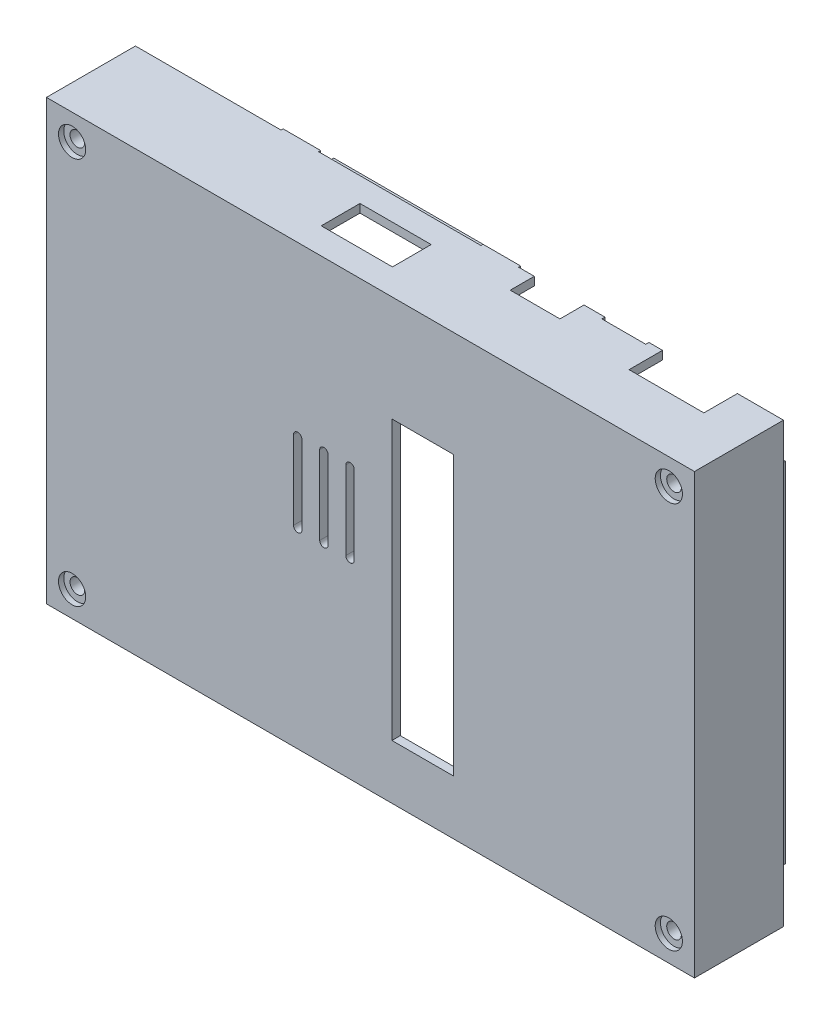
from build123d import *

# Parameters (mm, degrees)
SKETCH1_W               = 120.6
SKETCH1_H               = 80.6
BOSS_EXTRUDE1_DEPTH     = 1.6
SKETCH2_W               = 123.8
SKETCH2_H               = 83.8
BOSS_EXTRUDE2_DEPTH     = 1.6
SKETCH15_W              = 54.6
SKETCH15_H              = 1.6
BOSS_EXTRUDE10_DEPTH    = 15.4
SKETCH16_R              = 3.55
CUT_EXTRUDE5_DEPTH      = 15.5
BOSS_EXTRUDE11_DEPTH    = 15.4
SKETCH18_W              = 1.6
SKETCH18_H              = 3.2
SKETCH18_H_2            = 2.6
BOSS_EXTRUDE12_DEPTH    = 18
BOSS_EXTRUDE13_DEPTH    = 15.4
SKETCH20_W              = 15
SKETCH20_H              = 1.6
BOSS_EXTRUDE14_DEPTH    = 15.4
BOSS_EXTRUDE15_DEPTH    = 15.4
SKETCH22_W              = 62.6
SKETCH22_H              = 1.6
BOSS_EXTRUDE16_DEPTH    = 6
SKETCH23_W              = 1.6
SKETCH23_H              = 31.4
BOSS_EXTRUDE17_DEPTH    = 5.6
SKETCH24_W              = 1.6
SKETCH24_H              = 24.7
BOSS_EXTRUDE18_DEPTH    = 5.6
SKETCH25_W              = 11.5
SKETCH25_H              = 1.6
BOSS_EXTRUDE19_DEPTH    = 10.8
SKETCH26_W              = 14.3
SKETCH26_H              = 1.6
BOSS_EXTRUDE20_DEPTH    = 9
SKETCH27_W              = 8.4
SKETCH27_H              = 1.6
CUT_EXTRUDE6_DEPTH      = 0.6
SKETCH29_W              = 7
SKETCH29_H              = 7
BOSS_EXTRUDE21_DEPTH    = 2
CUT_EXTRUDE8_DEPTH      = 77.884458768
CUT_EXTRUDE8_DEPTH_BACK = 77.884458768
SKETCH28_R              = 1.4
SKETCH30_R              = 2.6
CUT_EXTRUDE9_DEPTH      = 1
SKETCH31_W              = 11.8
SKETCH31_H              = 53.2
CUT_EXTRUDE11_DEPTH     = 78.274704788
SKETCH32_W              = 13.6
SKETCH32_H              = 7.4
CUT_EXTRUDE12_DEPTH     = 10
SKETCH34_W              = 7.2
SKETCH34_H              = 1.6
BOSS_EXTRUDE22_DEPTH    = 0.4
SKETCH35_W              = 7.2
SKETCH35_H              = 1.6
BOSS_EXTRUDE23_DEPTH    = 0.4
SKETCH36_W              = 4
SKETCH36_H              = 66.6
BOSS_EXTRUDE25_DEPTH    = 1.2
SKETCH37_W              = 4
SKETCH37_H              = 11.4
BOSS_EXTRUDE31_DEPTH    = 1.2
SKETCH37_2_W            = 4
SKETCH37_2_H            = 11.4
BOSS_EXTRUDE36_DEPTH    = 1.2
SKETCH37_3_W            = 4
SKETCH37_3_H            = 11.4
BOSS_EXTRUDE37_DEPTH    = 1.2
SKETCH38_W              = 29.4
SKETCH38_H              = 4
BOSS_EXTRUDE40_DEPTH    = 1.2
CHAMFER1_SIZE           = 1.2
SKETCH39_W              = 18
SKETCH39_H              = 2.6
BOSS_EXTRUDE41_DEPTH    = 2


with BuildPart() as part:
    # Sketch1 → Boss-Extrude1 (new body)
    with BuildSketch(Plane.XY):
        Rectangle(SKETCH1_W, SKETCH1_H)
    extrude(amount=BOSS_EXTRUDE1_DEPTH)

    # Sketch2 → Boss-Extrude2 (add)
    with BuildSketch(Plane.XY):
        Rectangle(SKETCH2_W, SKETCH2_H)
    extrude(amount=BOSS_EXTRUDE2_DEPTH)

    # Sketch15 → Boss-Extrude10 (add)
    with BuildSketch(Plane(origin=(0, 0, 0), x_dir=(-1, 0, 0), z_dir=(0, 0, -1))):
        with Locations((-34.6, -41.1)):
            Rectangle(SKETCH15_W, SKETCH15_H)
    extrude(amount=BOSS_EXTRUDE10_DEPTH)

    # Sketch16 → Cut-Extrude5 (cut)
    with BuildSketch(Plane.XZ.offset(41.9)):
        with Locations((47.3, -15.4)):
            Circle(SKETCH16_R)
        with Locations((32.1, -15.4)):
            Circle(SKETCH16_R)
    extrude(amount=-CUT_EXTRUDE5_DEPTH, mode=Mode.SUBTRACT)

    # Sketch17 → Boss-Extrude11 (add)
    with BuildSketch(Plane(origin=(0, 0, 0), x_dir=(-1, 0, 0), z_dir=(0, 0, -1))):
        Polygon((55.3, -41.9), (61.9, -41.9), (61.9, -26.1), (60.3, -26.1), (60.3, -40.3), (55.3, -40.3), align=None)
    extrude(amount=BOSS_EXTRUDE11_DEPTH)

    # Sketch18 → Boss-Extrude12 (add)
    with BuildSketch(Plane(origin=(0, 0, 0), x_dir=(-1, 0, 0), z_dir=(0, 0, -1))):
        with Locations((61.1, -24.5)):
            Rectangle(SKETCH18_W, SKETCH18_H)
        with Locations((61.1, 9.8)):
            Rectangle(SKETCH18_W, SKETCH18_H_2)
    extrude(amount=BOSS_EXTRUDE12_DEPTH)

    # Sketch19 → Boss-Extrude13 (add)
    with BuildSketch(Plane(origin=(0, 0, 0), x_dir=(-1, 0, 0), z_dir=(0, 0, -1))):
        Polygon((60.3, 35.8), (61.9, 35.8), (61.9, 41.9), (-14.3, 41.9), (-14.3, 40.3), (60.3, 40.3), align=None)
    extrude(amount=BOSS_EXTRUDE13_DEPTH)

    # Sketch20 → Boss-Extrude14 (add)
    with BuildSketch(Plane(origin=(0, 0, 0), x_dir=(-1, 0, 0), z_dir=(0, 0, -1))):
        with Locations((-31.3, 41.1)):
            Rectangle(SKETCH20_W, SKETCH20_H)
    extrude(amount=BOSS_EXTRUDE14_DEPTH)

    # Sketch21 → Boss-Extrude15 (add)
    with BuildSketch(Plane(origin=(0, 0, 0), x_dir=(-1, 0, 0), z_dir=(0, 0, -1))):
        Polygon((-53.1, 40.3), (-53.1, 41.9), (-61.9, 41.9), (-61.9, -40.3), (-60.3, -40.3), (-60.3, 40.3), align=None)
    extrude(amount=BOSS_EXTRUDE15_DEPTH)

    # Sketch22 → Boss-Extrude16 (add)
    with BuildSketch(Plane(origin=(0, 0, 0), x_dir=(-1, 0, 0), z_dir=(0, 0, -1))):
        with Locations((24, -41.1)):
            Rectangle(SKETCH22_W, SKETCH22_H)
    extrude(amount=BOSS_EXTRUDE16_DEPTH)

    # Sketch23 → Boss-Extrude17 (add)
    with BuildSketch(Plane(origin=(0, 0, 0), x_dir=(-1, 0, 0), z_dir=(0, 0, -1))):
        with Locations((61.1, -7.2)):
            Rectangle(SKETCH23_W, SKETCH23_H)
    extrude(amount=BOSS_EXTRUDE17_DEPTH)

    # Sketch24 → Boss-Extrude18 (add)
    with BuildSketch(Plane(origin=(0, 0, 0), x_dir=(-1, 0, 0), z_dir=(0, 0, -1))):
        with Locations((61.1, 23.45)):
            Rectangle(SKETCH24_W, SKETCH24_H)
    extrude(amount=BOSS_EXTRUDE18_DEPTH)

    # Sketch25 → Boss-Extrude19 (add)
    with BuildSketch(Plane(origin=(0, 0, 0), x_dir=(-1, 0, 0), z_dir=(0, 0, -1))):
        with Locations((-19.65, 41.1)):
            Rectangle(SKETCH25_W, SKETCH25_H)
    extrude(amount=BOSS_EXTRUDE19_DEPTH)

    # Sketch26 → Boss-Extrude20 (add)
    with BuildSketch(Plane(origin=(0, 0, 0), x_dir=(-1, 0, 0), z_dir=(0, 0, -1))):
        with Locations((-45.95, 41.1)):
            Rectangle(SKETCH26_W, SKETCH26_H)
    extrude(amount=BOSS_EXTRUDE20_DEPTH)

    # Sketch27 → Cut-Extrude6 (cut)
    with BuildSketch(Plane(origin=(0, 0, -15.4), x_dir=(-1, 0, 0), z_dir=(0, 0, -1))):
        with Locations((-32, 41.1)):
            Rectangle(SKETCH27_W, SKETCH27_H)
    extrude(amount=-CUT_EXTRUDE6_DEPTH, mode=Mode.SUBTRACT)

    # Sketch29 → Boss-Extrude21 (add)
    with BuildSketch(Plane(origin=(0, 0, 0), x_dir=(-1, 0, 0), z_dir=(0, 0, -1))):
        with Locations((-56.8, -36.8)):
            Rectangle(SKETCH29_W, SKETCH29_H)
        with Locations((-56.8, 36.8)):
            Rectangle(SKETCH29_W, SKETCH29_H)
        with Locations((56.8, 36.8)):
            Rectangle(SKETCH29_W, SKETCH29_H)
        with Locations((56.8, -36.8)):
            Rectangle(SKETCH29_W, SKETCH29_H)
    extrude(amount=BOSS_EXTRUDE21_DEPTH)

    # Sketch28 → Cut-Extrude8 (cut, two sides: drawn at the far end of the back side and taken through both)
    with BuildSketch(Plane(origin=(0, 0, 0), x_dir=(-1, 0, 0), z_dir=(0, 0, -1)).offset(-CUT_EXTRUDE8_DEPTH_BACK)):
        with Locations((-57, 37)):
            Circle(SKETCH28_R)
        with Locations((57, 37)):
            Circle(SKETCH28_R)
        with Locations((57, -37)):
            Circle(SKETCH28_R)
        with Locations((-57, -37)):
            Circle(SKETCH28_R)
    extrude(amount=CUT_EXTRUDE8_DEPTH + CUT_EXTRUDE8_DEPTH_BACK, mode=Mode.SUBTRACT)

    # Sketch30 → Cut-Extrude9 (cut)
    with BuildSketch(Plane.XY.offset(1.6)):
        with Locations((-57, 37)):
            Circle(SKETCH30_R)
        with Locations((57, 37)):
            Circle(SKETCH30_R)
        with Locations((57, -37)):
            Circle(SKETCH30_R)
        with Locations((-57, -37)):
            Circle(SKETCH30_R)
    extrude(amount=-CUT_EXTRUDE9_DEPTH, mode=Mode.SUBTRACT)

    # Sketch31 → Cut-Extrude11 (cut, through all)
    with BuildSketch(Plane.XY.offset(1.6)):
        with Locations((10, -4.9)):
            Rectangle(SKETCH31_W, SKETCH31_H)
        with BuildLine():
            Line((-8.1, 9.7), (-8.1, -5.3))
            ThreePointArc((-8.1, -5.3), (-8.9, -6.1), (-9.7, -5.3))
            Line((-9.7, -5.3), (-9.7, 9.7))
            ThreePointArc((-9.7, 9.7), (-8.9, 10.5), (-8.1, 9.7))
        make_face()
        with BuildLine():
            Line((-13.1, 9.7), (-13.1, -5.3))
            ThreePointArc((-13.1, -5.3), (-13.9, -6.1), (-14.7, -5.3))
            Line((-14.7, -5.3), (-14.7, 9.7))
            ThreePointArc((-14.7, 9.7), (-13.9, 10.5), (-13.1, 9.7))
        make_face()
        with BuildLine():
            Line((-3.1, 9.7), (-3.1, -5.3))
            ThreePointArc((-3.1, -5.3), (-3.9, -6.1), (-4.7, -5.3))
            Line((-4.7, -5.3), (-4.7, 9.7))
            ThreePointArc((-4.7, 9.7), (-3.9, 10.5), (-3.1, 9.7))
        make_face()
    extrude(amount=-CUT_EXTRUDE11_DEPTH, mode=Mode.SUBTRACT)

    # Sketch32 → Cut-Extrude12 (cut)
    with BuildSketch(Plane(origin=(0, 41.9, 0), x_dir=(1, 0, 0), z_dir=(0, 1, 0))):
        with Locations((-7.6, 7.1)):
            Rectangle(SKETCH32_W, SKETCH32_H)
    extrude(amount=-CUT_EXTRUDE12_DEPTH, mode=Mode.SUBTRACT)

    # Sketch34 → Boss-Extrude22 (add)
    with BuildSketch(Plane(origin=(0, 0, -15.4), x_dir=(-1, 0, 0), z_dir=(0, 0, -1))):
        with Locations((-7.7, 41.1)):
            Rectangle(SKETCH34_W, SKETCH34_H)
        with Locations((30.5, 41.1)):
            Rectangle(SKETCH34_W, SKETCH34_H)
    extrude(amount=BOSS_EXTRUDE22_DEPTH)

    # Sketch35 → Boss-Extrude23 (add)
    with BuildSketch(Plane(origin=(0, 0, -15.4), x_dir=(-1, 0, 0), z_dir=(0, 0, -1))):
        with Locations((-17.7, -41.1)):
            Rectangle(SKETCH35_W, SKETCH35_H)
    extrude(amount=BOSS_EXTRUDE23_DEPTH)

    # Sketch36 → Boss-Extrude25 (add)
    with BuildSketch(Plane.ZY.offset(-60.3)):
        with Locations((-15.4, 0)):
            Rectangle(SKETCH36_W, SKETCH36_H)
    extrude(amount=BOSS_EXTRUDE25_DEPTH)

    # Sketch37 → Boss-Extrude31 (add)
    with BuildSketch(Plane(origin=(-60.3, 0, 0), x_dir=(0, 0, -1), z_dir=(1, 0, 0))):
        with Locations((15.317328584, -28.6)):
            Rectangle(SKETCH37_W, SKETCH37_H)
    extrude(amount=BOSS_EXTRUDE31_DEPTH)

    # Sketch37<2> → Boss-Extrude36 (add)
    with BuildSketch(Plane(origin=(-60.3, 0, 0), x_dir=(0, 0, -1), z_dir=(1, 0, 0))):
        with Locations((15.317328584, -28.6)):
            Rectangle(SKETCH37_2_W, SKETCH37_2_H)
    extrude(amount=BOSS_EXTRUDE36_DEPTH)

    # Sketch37<3> → Boss-Extrude37 (add)
    with BuildSketch(Plane(origin=(-60.3, 0, 0), x_dir=(0, 0, -1), z_dir=(1, 0, 0))):
        with Locations((15.317328584, -28.6)):
            Rectangle(SKETCH37_3_W, SKETCH37_3_H)
    extrude(amount=BOSS_EXTRUDE37_DEPTH)

    # Sketch38 → Boss-Extrude40 (add)
    with BuildSketch(Plane.XZ.offset(-40.3)):
        with Locations((-11.3, -15.4)):
            Rectangle(SKETCH38_W, SKETCH38_H)
    extrude(amount=BOSS_EXTRUDE40_DEPTH)

    # Chamfer1
    chamfer1_edges = [part.edges().sort_by_distance(p)[0] for p in [
        (60.3, 0, -13.4),
        (-60.3, -28.6, -13.317328584),
        (-11.3, 40.3, -13.4),
    ]]
    chamfer(chamfer1_edges, length=CHAMFER1_SIZE - 0.0001)  # a hair under: the kernel refuses the full size

    # Sketch39 → Boss-Extrude41 (add)
    with BuildSketch(Plane(origin=(-60.3, 0, 0), x_dir=(0, 0, -1), z_dir=(1, 0, 0))):
        with Locations((9, 9.8)):
            Rectangle(SKETCH39_W, SKETCH39_H)
    extrude(amount=BOSS_EXTRUDE41_DEPTH)


solid = part.part
